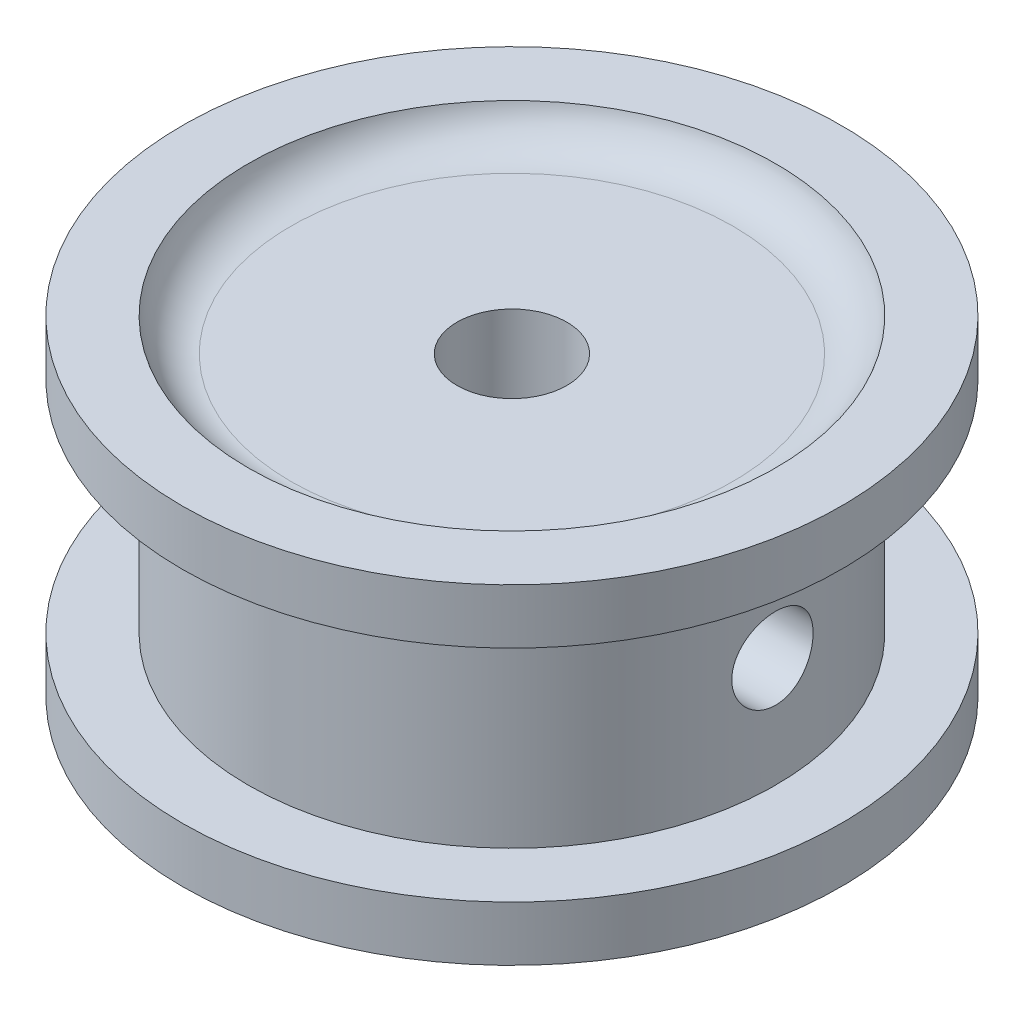
from build123d import *

# Parameters (mm, degrees)
BOSS_EXTRUDE6_DEPTH      = 6
BOSS_EXTRUDE7_DEPTH      = 0.995824486
BOSS_EXTRUDE7_DEPTH_BACK = 1.5
FILLET17_R               = 2
SKETCH4_R                = 2.5
CUT_EXTRUDE2_DEPTH       = 11.5
SKETCH11_R               = 1.4
CUT_EXTRUDE3_DEPTH       = 15
CUT_EXTRUDE10_DEPTH      = 0.5
CUT_EXTRUDE10_DEPTH_BACK = 2
SKETCH14_W               = 2.5
SKETCH14_H               = 6.5
CUT_EXTRUDE15_DEPTH      = 8.75
SKETCH16_R               = 1.85
CUT_EXTRUDE16_DEPTH      = 15


with BuildPart() as part:
    # Sketch1 → Boss-Extrude6 (new body)
    with BuildSketch(Plane(origin=(0, 0, 0), x_dir=(1, 0, 0), z_dir=(0, 1, 0))):
        with BuildLine():
            ThreePointArc((12, 0), (8.485281374, 8.485281374), (0, 12))
            ThreePointArc((0, 12), (-8.485281374, 8.485281374), (-12, 0))
            ThreePointArc((-12, 0), (-8.485281374, -8.485281374), (0, -12))
            ThreePointArc((0, -12), (8.485281374, -8.485281374), (12, 0))
        make_face()
    extrude(amount=BOSS_EXTRUDE6_DEPTH)

    # Sketch1<11> → Boss-Extrude7 (add, two sides: drawn at the far end of the back side and taken through both)
    with BuildSketch(Plane(origin=(0, 0, 0), x_dir=(1, 0, 0), z_dir=(0, 1, 0)).offset(-BOSS_EXTRUDE7_DEPTH_BACK)):
        with BuildLine():
            ThreePointArc((15, 0), (10.606601718, 10.606601718), (0, 15))
            ThreePointArc((0, 15), (-10.606601718, 10.606601718), (-15, 0))
            ThreePointArc((-15, 0), (-10.606601718, -10.606601718), (0, -15))
            ThreePointArc((0, -15), (10.606601718, -10.606601718), (15, 0))
        make_face()
        with BuildLine():
            ThreePointArc((12, 0), (8.485281374, 8.485281374), (0, 12))
            ThreePointArc((0, 12), (-8.485281374, 8.485281374), (-12, 0))
            ThreePointArc((-12, 0), (-8.485281374, -8.485281374), (0, -12))
            ThreePointArc((0, -12), (8.485281374, -8.485281374), (12, 0))
        make_face(mode=Mode.SUBTRACT)
    extrude(amount=BOSS_EXTRUDE7_DEPTH + BOSS_EXTRUDE7_DEPTH_BACK)


with BuildPart() as boss_extrude7_kept_piece:
    # of the separate pieces the step leaves, the one the design keeps (boss_extrude7_pieces_kept)
    add(part.part.solids().sort_by_distance((12, 6, 0))[0])

    # Fillet17
    # the kernel refuses this fillet: 2 mm, written as the material it adds along each edge
    with BuildSketch(Plane(origin=(0, 0, 0), x_dir=(1, 0, 0), z_dir=(0, 0, 1))) as fillet17_piece_1:
        with BuildLine():
            CenterArc((10.063508327, -2), FILLET17_R, 14.477512186, 75.522487814)
            Line((10.063508327, 0), (10.063508327, 0.04))
            Line((10.063508327, 0.04), (12, 0.04))
            Line((12, 0.04), (12.04, 0))
            ThreePointArc((12.04, 0), (12.04, -0.75), (12.038729833, -1.49))
            Line((12.038729833, -1.49), (12, -1.5))
        make_face()
    revolve(axis=Axis((0, 0, 0), (0, 1, 0)))

    # Sketch4 → Cut-Extrude2 (cut)
    with BuildSketch(Plane(origin=(0, 6, 0), x_dir=(1, 0, 0), z_dir=(0, 1, 0))):
        with Locations(Location((0, 0, 0), (0, 0, 270))):
            Circle(SKETCH4_R)
    extrude(amount=-CUT_EXTRUDE2_DEPTH, mode=Mode.SUBTRACT)

    # Mirror6: Boss-Extrude7 kept piece across plane


with BuildPart() as boss_extrude7_kept_piece_1:
    add(boss_extrude7_kept_piece.part)
    add(boss_extrude7_kept_piece.part.mirror(Plane.ZX.offset(6)))

    # Sketch11 → Cut-Extrude3 (cut)
    with BuildSketch(Plane(origin=(0, 0, 0), x_dir=(0, 0, -1), z_dir=(1, 0, 0))):
        with Locations((0, 6)):
            Circle(SKETCH11_R)
    extrude(amount=-CUT_EXTRUDE3_DEPTH, mode=Mode.SUBTRACT)

    # Sketch12 → Cut-Extrude10 (cut, two sides: drawn at the far end of the back side and taken through both)
    with BuildSketch(Plane(origin=(-3.5, 0, 0), x_dir=(0, 0, -1), z_dir=(1, 0, 0)).offset(-CUT_EXTRUDE10_DEPTH_BACK)):
        Polygon((3.175426481, 6), (1.58771324, 8.75), (-1.58771324, 8.75), (-3.175426481, 6), (-1.58771324, 3.25), (1.58771324, 3.25), align=None)
    extrude(amount=CUT_EXTRUDE10_DEPTH + CUT_EXTRUDE10_DEPTH_BACK, mode=Mode.SUBTRACT)

    # Sketch14 → Cut-Extrude15 (cut)
    with BuildSketch(Plane.XZ):
        with Locations((-4.75, 0)):
            Rectangle(SKETCH14_W, SKETCH14_H)
    extrude(amount=-CUT_EXTRUDE15_DEPTH, mode=Mode.SUBTRACT)

    # Sketch16 → Cut-Extrude16 (cut)
    with BuildSketch(Plane(origin=(0, 0, 0), x_dir=(0, 0, -1), z_dir=(1, 0, 0))):
        with Locations(Location((0, 6, 0), (0, 0, 180))):
            Circle(SKETCH16_R)
    extrude(amount=CUT_EXTRUDE16_DEPTH, mode=Mode.SUBTRACT)


solid = boss_extrude7_kept_piece_1.part
